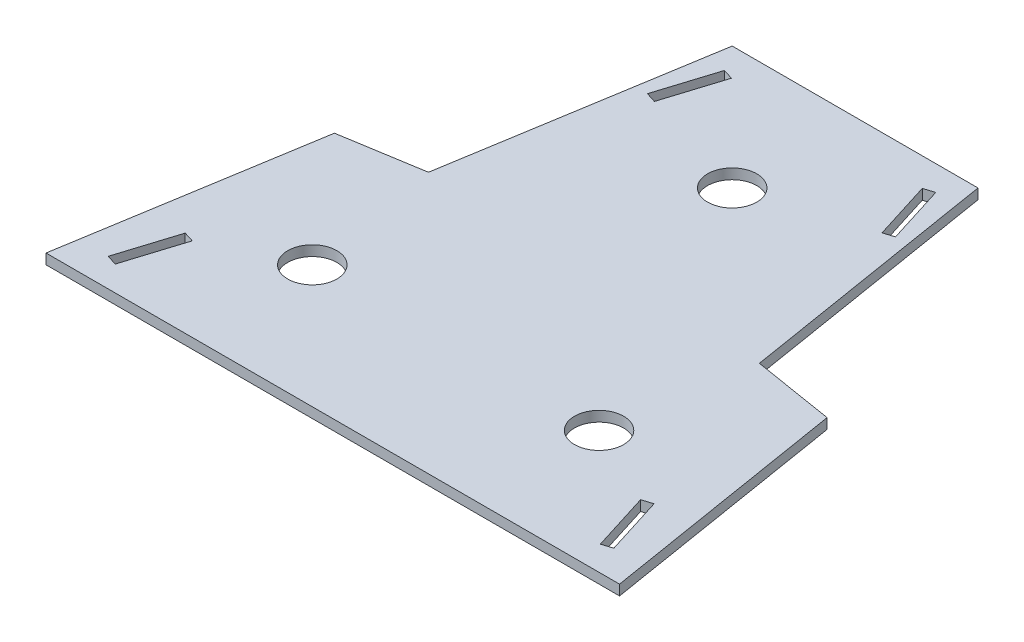
from build123d import *

# Parameters (mm, degrees)
SKETCH1_R           = 12
BOSS_EXTRUDE1_DEPTH = 5
CUT_EXTRUDE1_DEPTH  = 5


with BuildPart() as part:
    # Sketch1 → Boss-Extrude1 (new body)
    with BuildSketch(Plane(origin=(0, 0, 0), x_dir=(1, 0, 0), z_dir=(0, 1, 0))):
        Polygon((-140, 0), (140, 0), (120.264015595, 121.064121849), (80.785167176, 127.5), (60, 255), (-60, 255), (-80.785167176, 127.5), (-120.264015595, 121.064121849), align=None)
        with Locations((0, 195)):
            Circle(SKETCH1_R, mode=Mode.SUBTRACT)
        with Locations((-70, 60)):
            Circle(SKETCH1_R, mode=Mode.SUBTRACT)
        with Locations((70, 60)):
            Circle(SKETCH1_R, mode=Mode.SUBTRACT)
    extrude(amount=BOSS_EXTRUDE1_DEPTH)

    # Sketch2 → Cut-Extrude1 (cut)
    with BuildSketch(Plane(origin=(0, 5, 0), x_dir=(1, 0, 0), z_dir=(0, 1, 0))):
        Polygon((-60.564027822, 214.158951579), (-51.583825585, 242.783346206), (-46.574556526, 241.211810815), (-55.554758762, 212.587416187), align=None)
        Polygon((-118.416174415, 12.216653794), (-109.435972178, 40.841048421), (-114.445241238, 42.412583813), (-123.425443474, 13.788189185), align=None)
        Polygon((123.425443474, 13.788189185), (114.445241238, 42.412583813), (109.435972178, 40.841048421), (118.416174415, 12.216653794), align=None)
        Polygon((55.554758762, 212.587416187), (46.574556526, 241.211810815), (51.583825585, 242.783346206), (60.564027822, 214.158951579), align=None)
    extrude(amount=-CUT_EXTRUDE1_DEPTH, mode=Mode.SUBTRACT)


solid = part.part
